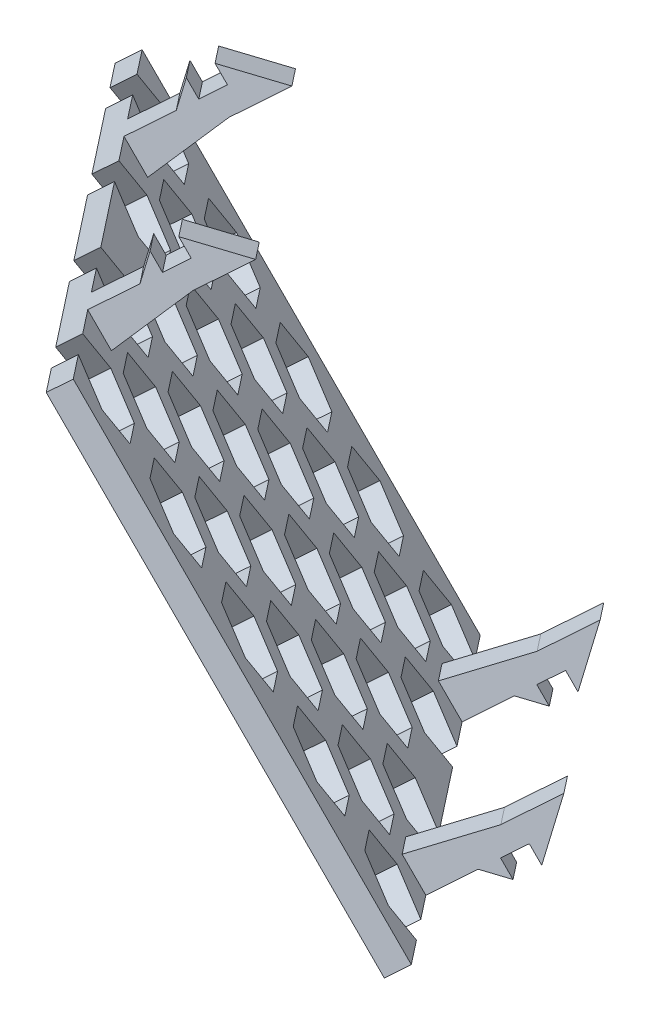
from build123d import *

# Parameters (mm, degrees)
EXTRUDE_1_DEPTH             = 3
EXTRUDE_2_DEPTH             = 5
CHAMFER_1_SIZE              = 10
CHAMFER_1_SIZE2             = 1.7632698070846535
CHAMFER_1_OF_MIRROR_1_SIZE2 = 1.7632698070846535
CHAMFER_1_OF_MIRROR_1_SIZE  = 10
MIRROR_START                = 100.557274191
MIRROR_2_DEPTH              = 5
MIRROR_START_2              = 150.557274191
MIRROR_2_2_DEPTH            = 5
CUT_EXTRUDE_START           = -3
CUT_EXTRUDE_1_DEPTH         = 3
EXTRUDE_3_DEPTH             = 5
MIRROR_4_COPY_1_DEPTH       = 5


# Read off the part's stored shape, not the designer's step: 镜向2, 切除-拉伸1
with BuildPart() as part:
    # 草图1 → 凸台-拉伸1 (new body)
    with BuildSketch(Plane(origin=(-237.77557772527013, -202.07965469386826, 279.460092225235), x_dir=(0.823284870968576, -0.3326085977835135, 0.459971240312631), z_dir=(-0.5676284182757724, -0.4824135256318378, 0.6671395424146325))):
        Polygon((-17.997337966972122, 146.44323750636548), (54.672039847409344, 207.63279158278186), (98.47087855473896, 155.61681588406668), (25.801500740357504, 94.42726180765032), align=None)
    extrude(amount=EXTRUDE_1_DEPTH)

    # 草图2 → 凸台-拉伸2 (add)
    with BuildSketch(Plane(origin=(66.47619270984528, 28.238015488090646, 76.97966237087908), x_dir=(-0.7767863592562881, 0.2168814389007045, 0.5912405547099429), z_dir=(-0.6297642035503137, -0.2675136858592245, -0.7292691381133932))):
        Polygon((392.6787372516959, -197.67947362282524), (382.0830155749163, -187.78095443315775), (383.7896568145141, -185.95410586819565), (376.01597924448214, -186.21856198399666), (390.6307677641784, -199.87169190077967), align=None)
    extrude_2 = extrude(amount=EXTRUDE_2_DEPTH)

    # 倒角1
    chamfer_1_edges = [part.edges().sort_by_distance(p)[0] for p in [
        (-236.83198444922786, -73.90819701475317, 372.944665058976),
    ]]
    chamfer_1_side = [part.faces().sort_by_distance(p)[0] for p in [
        (-232.00714289388384, -69.80768204688258, 367.2739789484516),
    ]]
    chamfer(chamfer_1_edges, length=CHAMFER_1_SIZE, length2=CHAMFER_1_SIZE2, reference=chamfer_1_side[0])

    # 镜向1: 凸台-拉伸2 across plane
    add(extrude_2.mirror(Plane(origin=(80.64588728972736, 34.25707341992324, 93.38821797843048), x_dir=(-0.6712211429872029, -0.2851239257088115, 0.6842269537188292), z_dir=(0.6297642035503136, 0.26751368585922486, 0.729269138113393))))

    # 倒角1 of 镜向1
    chamfer_1_of_mirror_1_edges = [part.edges().sort_by_distance(p)[0] for p in [
        (-205.3437742717121, -60.53251272179189, 409.4081219646457),
    ]]
    chamfer(chamfer_1_of_mirror_1_edges, length=CHAMFER_1_OF_MIRROR_1_SIZE, length2=CHAMFER_1_OF_MIRROR_1_SIZE2)

    # 镜向2 outline → 镜向2 (add)
    with BuildSketch(Plane(origin=(0, 0, 0), x_dir=(0.7767863592562926, -0.21688143890070571, -0.5912405547099364), z_dir=(0.629764203550308, 0.26751368585923, 0.7292691381133961)).offset(MIRROR_START)):
        Polygon((-344.065877257, -245.321785102), (-335.662373858, -237.4712354), (-333.955732618, -239.298083965), (-333.691276502, -231.524406395), (-338.806452484, -236.303001866), (-347.317554332, -241.841076058), align=None)
    extrude(amount=MIRROR_2_DEPTH)

    # Mirror 2 2 outline → Mirror 2 2 (add)
    with BuildSketch(Plane(origin=(0, 0, 0), x_dir=(0.7767863592562926, -0.21688143890070571, -0.5912405547099364), z_dir=(0.629764203550308, 0.26751368585923, 0.7292691381133961)).offset(MIRROR_START_2)):
        Polygon((-344.065877257, -245.321785102), (-335.662373858, -237.4712354), (-333.955732618, -239.298083965), (-333.691276502, -231.524406395), (-338.806452484, -236.303001866), (-347.317554332, -241.841076058), align=None)
    extrude(amount=MIRROR_2_2_DEPTH)

    # 切除-拉伸1 outline → 切除-拉伸1 (cut)
    with BuildSketch(Plane(origin=(-239.47846298009733, -203.52689527076382, 281.46151085247897), x_dir=(0.8232848709685762, -0.3326085977835133, 0.45997124031263076), z_dir=(-0.5676284182757722, -0.48241352563183804, 0.6671395424146325)).offset(CUT_EXTRUDE_START)):
        Polygon((-11.539182151, 145.08829532), (-5.897514961, 143.045847938), (-1.307870046, 146.910451353), (-2.359892322, 152.817502151), (-8.001559512, 154.859949534), (-12.591204427, 150.995346118), align=None)
        Polygon((49.265906307, 203.080682971), (44.676261393, 199.216079555), (45.728283669, 193.309028757), (51.369950859, 191.266581375), (55.959595774, 195.13118479), (54.907573498, 201.038235588), align=None)
        Polygon((30.176751034, 187.007105158), (25.58710612, 183.142501743), (26.639128396, 177.235450945), (32.280795586, 175.193003562), (36.870440501, 179.057606978), (35.818418225, 184.964657776), align=None)
        Polygon((11.087595761, 170.933527346), (6.497950846, 167.068923931), (7.549973122, 161.161873133), (13.191640313, 159.11942575), (17.781285227, 162.984029165), (16.729262951, 168.891079963), align=None)
        Polygon((82.735446524, 167.982016712), (77.093779334, 170.024464094), (72.504134419, 166.159860679), (73.556156695, 160.252809881), (79.197823885, 158.210362498), (83.7874688, 162.074965914), align=None)
        Polygon((19.833738654, 121.809982824), (15.244093739, 117.945379408), (16.296116015, 112.03832861), (21.937783206, 109.995881228), (26.52742812, 113.860484643), (25.475405844, 119.767535441), align=None)
        Polygon((63.647776993, 151.914209588), (58.006109802, 153.956656971), (53.416464887, 150.092053555), (54.468487163, 144.185002757), (60.110154354, 142.142555375), (64.699799269, 146.00715879), align=None)
        Polygon((38.916954529, 137.883079158), (34.327309614, 134.018475743), (35.37933189, 128.111424945), (41.020999081, 126.068977562), (45.610643995, 129.933580978), (44.558621719, 135.840631776), align=None)
        Polygon((31.428171122, 127.404806737), (30.376148846, 133.311857535), (24.734481656, 135.354304917), (20.144836741, 131.489701502), (21.196859017, 125.582650704), (26.838526207, 123.540203321), align=None)
        Polygon((45.927681481, 139.613781133), (50.517326395, 143.478384549), (49.465304119, 149.385435347), (43.823636929, 151.42788273), (39.233992014, 147.563279314), (40.28601429, 141.656228516), align=None)
        Polygon((59.375169564, 157.729806328), (65.016836754, 155.687358946), (69.606481669, 159.551962361), (68.554459393, 165.459013159), (62.912792202, 167.501460542), (58.323147288, 163.636857127), align=None)
        Polygon((63.222393818, 177.177416296), (64.274416094, 171.270365498), (69.916083285, 169.227918116), (74.505728199, 173.092521531), (73.453705924, 178.999572329), (67.812038733, 181.042019712), align=None)
        Polygon((16.199124493, 130.789687892), (10.557457303, 132.832135275), (5.967812388, 128.967531859), (7.019834664, 123.060481061), (12.661501855, 121.018033679), (17.251146769, 124.882637094), align=None)
        Polygon((35.281837572, 146.857841204), (29.640170381, 148.900288587), (25.050525467, 145.035685172), (26.102547743, 139.128634374), (31.744214933, 137.086186991), (36.333859848, 140.950790406), align=None)
        Polygon((48.729325655, 164.973866399), (44.13968074, 161.109262984), (45.191703016, 155.202212186), (50.833370206, 153.159764803), (55.423015121, 157.024368219), (54.370992845, 162.931419017), align=None)
        Polygon((92.012722739, 156.97175807), (86.371055548, 159.014205453), (81.781410634, 155.149602037), (82.83343291, 149.242551239), (88.4751001, 147.200103857), (93.064745015, 151.064707272), align=None)
        Polygon((31.20763428, 98.97937042), (35.797279195, 102.843973835), (34.745256919, 108.751024633), (29.103589728, 110.793472016), (24.513944814, 106.928868601), (25.56596709, 101.021817802), align=None)
        Polygon((50.296789554, 115.052948232), (54.886434468, 118.917551647), (53.834412192, 124.824602445), (48.192745002, 126.867049828), (43.603100087, 123.002446413), (44.655122363, 117.095395615), align=None)
        Polygon((69.385944827, 131.126526044), (73.975589742, 134.99112946), (72.923567466, 140.898180258), (67.281900275, 142.94062764), (62.69225536, 139.076024225), (63.744277636, 133.168973427), align=None)
        Polygon((40.703961595, 116.388777406), (39.651939319, 122.295828204), (34.010272129, 124.338275587), (29.420627214, 120.473672172), (30.47264949, 114.566621374), (36.11431668, 112.524173991), align=None)
        Polygon((55.203471954, 128.597751803), (59.793116868, 132.462355219), (58.741094592, 138.369406017), (53.099427402, 140.411853399), (48.509782487, 136.547249984), (49.561804763, 130.640199186), align=None)
        Polygon((68.650960037, 146.713776998), (74.292627227, 144.671329616), (78.882272142, 148.535933031), (77.830249866, 154.442983829), (72.188582675, 156.485431212), (67.598937761, 152.620827796), align=None)
        Polygon((30.911735825, 171.419854204), (25.270068634, 173.462301587), (20.680423719, 169.597698172), (21.732445995, 163.690647374), (27.374113186, 161.648199991), (31.9637581, 165.512803406), align=None)
        Polygon((11.822580551, 155.346276392), (6.180913361, 157.388723775), (1.591268446, 153.52412036), (2.643290722, 147.617069561), (8.284957913, 145.574622179), (12.874602827, 149.439225594), align=None)
        Polygon((44.359223907, 189.535879399), (39.769578993, 185.671275984), (40.821601269, 179.764225186), (46.463268459, 177.721777803), (51.052913374, 181.586381219), (50.000891098, 187.493432017), align=None)
        Polygon((-2.261905936, 134.078036679), (3.379761254, 132.035589296), (7.969406169, 135.900192711), (6.917383893, 141.80724351), (1.275716702, 143.849690892), (-3.313928212, 139.985087477), align=None)
        Polygon((60.639801934, 180.250070567), (65.229446848, 184.114673982), (64.177424572, 190.02172478), (58.535757382, 192.064172163), (53.946112467, 188.199568748), (54.998134743, 182.292517949), align=None)
        Polygon((16.825763595, 150.145843803), (22.467430786, 148.10339642), (27.0570757, 151.967999835), (26.005053424, 157.875050633), (20.363386234, 159.917498016), (15.773741319, 156.052894601), align=None)
        Polygon((41.556586059, 164.176974232), (46.146230974, 168.041577647), (45.094208698, 173.948628445), (39.452541507, 175.991075828), (34.862896593, 172.126472413), (35.914918868, 166.219421615), align=None)
        Polygon((11.919081195, 136.601040231), (17.560748386, 134.558592849), (22.1503933, 138.423196264), (21.098371024, 144.330247062), (15.456703834, 146.372694445), (10.867058919, 142.508091029), align=None)
        Polygon((55.739058932, 166.705748473), (60.328703847, 170.570351888), (59.276681571, 176.477402687), (53.63501438, 178.519850069), (49.045369466, 174.655246654), (50.097391742, 168.748195856), align=None)
        Polygon((31.008236468, 152.674618044), (36.649903659, 150.632170661), (41.239548573, 154.496774076), (40.187526298, 160.403824874), (34.545859107, 162.446272257), (29.956214192, 158.581668842), align=None)
    extrude(amount=CUT_EXTRUDE_1_DEPTH, mode=Mode.SUBTRACT)

    # 草图4 → 凸台-拉伸3 (add)
    with BuildSketch(Plane(origin=(63.327371692094054, 26.900447058794068, 73.33331668031238), x_dir=(-0.7767863592562869, 0.216881438900701, 0.5912405547099456), z_dir=(-0.6297642035503151, -0.26751368585921925, -0.7292691381133939))):
        Polygon((384.41427131416793, -189.9588126645176), (386.12091255376583, -188.13196409955557), (386.24111987913, -191.66545390411545), align=None)
    extrude_3 = extrude(amount=-EXTRUDE_3_DEPTH)

    # 镜向3: 凸台-拉伸3 across plane
    add(extrude_3.mirror(Plane(origin=(80.64588728972736, 34.25707341992324, 93.38821797843048), x_dir=(-0.6712211429872029, -0.2851239257088115, 0.6842269537188292), z_dir=(0.6297642035503136, 0.26751368585922486, 0.729269138113393))))

    # 镜向4: 凸台-拉伸3 across plane
    add(extrude_3.mirror(Plane(origin=(-47.51956305013527, 74.74529721721271, 13.617372927364071), x_dir=(0.08152701690098424, -0.12823689273126515, 0.9883868902701293), z_dir=(-0.5302782540255494, 0.8340944899503124, 0.1519583993800388))))

    # 镜向4 copy 1 sketch → 镜向4 copy 1 (add)
    with BuildSketch(Plane(origin=(2.9252767870896434, 191.10429421547795, 140.67786513127697), x_dir=(-0.05279056983072454, -0.9219186045157413, 0.3837697778417371), z_dir=(0.6297642035503167, 0.2675136858592234, 0.7292691381133909))):
        Polygon((384.41427131416793, -189.9588126645176), (386.12091255376583, -188.13196409955557), (386.24111987913, -191.66545390411545), align=None)
    extrude(amount=-MIRROR_4_COPY_1_DEPTH)


solid = part.part
